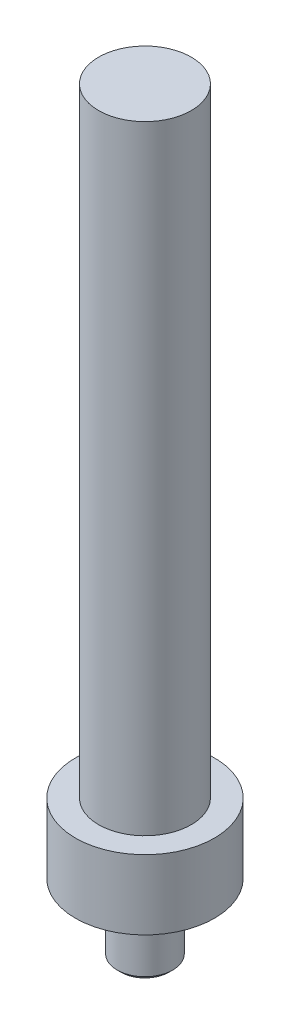
from build123d import *

# Parameters (mm, degrees)
SKETCH1_R           = 15
BOSS_EXTRUDE1_DEPTH = 15
SKETCH2_R           = 10
BOSS_EXTRUDE2_DEPTH = 133.5
SKETCH4_R           = 7.5
BOSS_EXTRUDE3_DEPTH = 15


# Read off the part's stored shape, not the designer's step: M12x1.5 Machine Threads Stud1
with BuildPart() as part:
    # Sketch1 → Boss-Extrude1 (new body)
    with BuildSketch(Plane(origin=(0, 0, 0), x_dir=(1, 0, 0), z_dir=(0, 1, 0))):
        with Locations(Location((0, 0, 0), (0, 0, 270))):
            Circle(SKETCH1_R)
    extrude(amount=BOSS_EXTRUDE1_DEPTH)

    # Sketch2 → Boss-Extrude2 (add)
    with BuildSketch(Plane(origin=(0, 15, 0), x_dir=(1, 0, 0), z_dir=(0, 1, 0))):
        with Locations(Location((0, 0, 0), (0, 0, 270))):
            Circle(SKETCH2_R)
    extrude(amount=BOSS_EXTRUDE2_DEPTH)

    # Sketch4 → Boss-Extrude3 (add)
    with BuildSketch(Plane.XZ):
        with Locations(Location((0, 0, 0), (0, 0, 270))):
            Circle(SKETCH4_R)
    extrude(amount=BOSS_EXTRUDE3_DEPTH)

    # M12x1.5 Machine Threads Stud1 outline → M12x1.5 Machine Threads Stud1 (revolve, cut)
    with BuildSketch(Plane.XY):
        Polygon((7.5, 0), (6, 0), (6, -14.172), (5.172, -15), (7.5, -15), align=None)
    revolve(axis=Axis((0, 0, 0), (0, 1, 0)), mode=Mode.SUBTRACT)


solid = part.part
